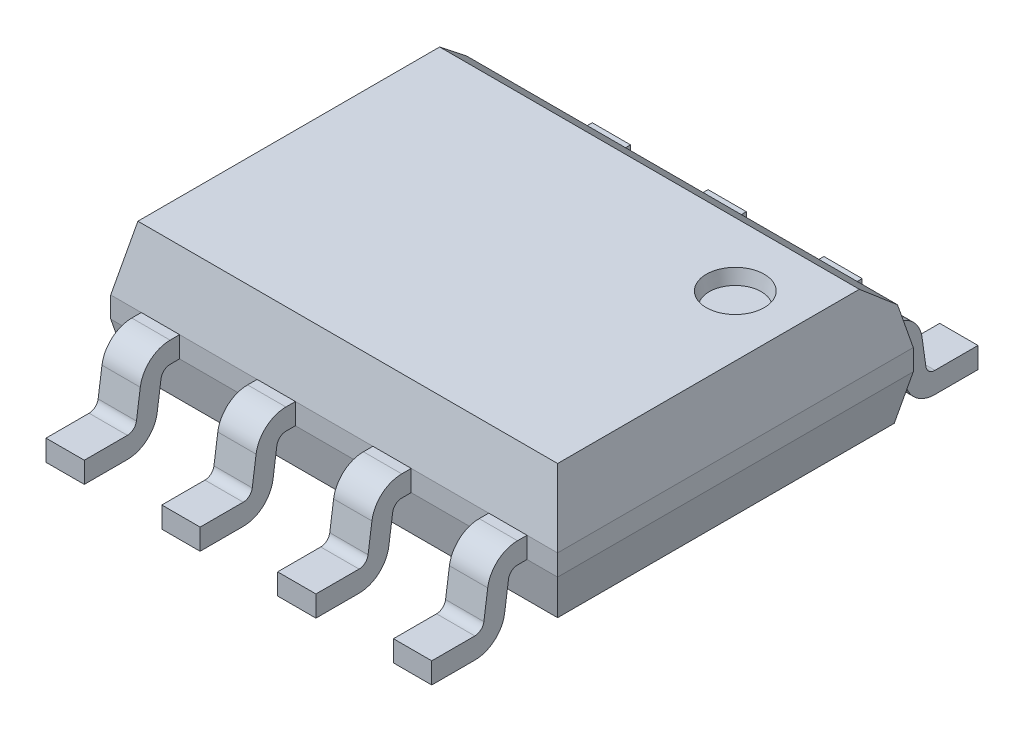
from build123d import *

# Parameters (mm, degrees)
SKETCH1_W                = 4.9
SKETCH1_H                = 3.9
EXTRUDE1_DEPTH           = 0.7
EXTRUDE1_TAPER           = 12
EXTRUDE1_OTHER_WAY_DEPTH = 0.23
SKETCH2_W                = 4.9
SKETCH2_H                = 3.9
EXTRUDE2_DEPTH           = 0.49
EXTRUDE2_TAPER           = 12
CHAMFER1_SIZE            = 0.29360287
CHAMFER1_SIZE_2          = 0.3
SKETCH3_R                = 0.317461986
CUT_EXTRUDE1_DEPTH       = 0.15
CUT_EXTRUDE1_DRAFT       = -12
EXTRUDE3_DEPTH           = 0.21
LPATTERN3_COUNT          = 2
LPATTERN3_PITCH          = 1.27
LPATTERN3_COL_COUNT      = 3
LPATTERN3_COL_PITCH      = 1.27
FILLET1_R                = 0.1
FILLET2_R                = 0.33


with BuildPart() as part:
    # Sketch1 → Extrude1 (new body)
    with BuildSketch(Plane(origin=(0, 0, 0), x_dir=(1, 0, 0), z_dir=(0, 1, 0))):
        with Locations((-0.635, 0)):
            Rectangle(SKETCH1_W, SKETCH1_H)
    extrude(amount=EXTRUDE1_DEPTH, taper=EXTRUDE1_TAPER)

    # Sketch1 → Extrude1 other way (add)
    with BuildSketch(Plane(origin=(0, 0, 0), x_dir=(1, 0, 0), z_dir=(0, 1, 0))):
        with Locations((-0.635, 0)):
            Rectangle(SKETCH1_W, SKETCH1_H)
    extrude(amount=-EXTRUDE1_OTHER_WAY_DEPTH)

    # Sketch2 → Extrude2 (add)
    with BuildSketch(Plane.XZ.offset(0.23)):
        with Locations((-0.635, 0)):
            Rectangle(SKETCH2_W, SKETCH2_H)
    extrude(amount=EXTRUDE2_DEPTH, taper=EXTRUDE2_TAPER)

    # Chamfer1
    # the kernel refuses this chamfer: 0.3, 0.29360287 mm, written as the material it takes off along each edge
    with BuildSketch(Plane(origin=(2.439914076, 0.7, -1.801210407), x_dir=(0, 0.025194664498195983, 0.9996825640576229), z_dir=(-1, 0, 0))) as chamfer1_piece_1:
        Polygon((CHAMFER1_SIZE * 0.999682563914, -CHAMFER1_SIZE * 0.0251946644946), (-CHAMFER1_SIZE_2 * 0.232489792804, -CHAMFER1_SIZE_2 * 0.972598836233), (0, 0), align=None)
    extrude(amount=6.149828151, mode=Mode.SUBTRACT)


with BuildPart() as cut_extrude1_tool:
    # Sketch3 → Cut-Extrude1 (with draft: the straight prism first)
    with BuildSketch(Plane(origin=(0, 0.7, 0), x_dir=(-1, 0, 0), z_dir=(0, 1, 0))):
        with Locations((-1.001533305, -0.811859934)):
            Circle(SKETCH3_R)
    extrude(amount=-CUT_EXTRUDE1_DEPTH)
    # Cut-Extrude1: the draft: its side faces are tilted about the plane it starts from
    cut_extrude1_sides = [cut_extrude1_tool.faces().sort_by_distance(p)[0] for p in [
        (1.318995291, 0.625, -0.811859934),
    ]]
    draft(cut_extrude1_sides, Plane(origin=(0, 0.7, 0), x_dir=(-1, 0, 0), z_dir=(0, 1, 0)), CUT_EXTRUDE1_DRAFT)


with BuildPart() as part_1:
    add(part.part)

    # Cut-Extrude1: cut by cut_extrude1_tool
    add(cut_extrude1_tool.part, mode=Mode.SUBTRACT)

    # Sketch4 → Extrude3 (add, symmetric)
    with BuildSketch(Plane(origin=(0, 0, 0), x_dir=(0, 0, -1), z_dir=(1, 0, 0))):
        Polygon((1.95, -0.23), (-1.95, -0.23), (-2.141337425, -0.23), (-2.235499784, -0.9), (-2.995, -0.9), (-2.995, -0.67), (-2.435435734, -0.67), (-2.341273375, 0), (-1.95, 0), (1.95, 0), (2.341273375, 0), (2.435435734, -0.67), (2.995, -0.67), (2.995, -0.9), (2.235499784, -0.9), (2.141337425, -0.23), align=None)
    extrude3 = extrude(amount=EXTRUDE3_DEPTH, both=True)

    # LPattern3: Extrude3 ×2
    with Locations(*[(i * LPATTERN3_PITCH, 0, 0) for i in range(1, LPATTERN3_COUNT)]):
        add(extrude3)

    # LPattern3 col: Extrude3 ×3
    with Locations(*[(-i * LPATTERN3_COL_PITCH, 0, 0) for i in range(1, LPATTERN3_COL_COUNT)]):
        add(extrude3)

    # Fillet1
    fillet1_edges = [part_1.edges().sort_by_distance(p)[0] for p in [
        (-1.27, -0.23, 2.141337425),
        (-1.27, -0.23, -2.141337425),
        (-1.27, -0.67, -2.435435734),
        (-1.27, -0.67, 2.435435734),
        (-2.54, -0.23, 2.141337425),
        (-2.54, -0.23, -2.141337425),
        (-2.54, -0.67, -2.435435734),
        (-2.54, -0.67, 2.435435734),
        (1.27, -0.23, 2.141337425),
        (1.27, -0.23, -2.141337425),
        (1.27, -0.67, -2.435435734),
        (1.27, -0.67, 2.435435734),
        (0, -0.23, 2.141337425),
        (0, -0.23, -2.141337425),
        (0, -0.67, -2.435435734),
        (0, -0.67, 2.435435734),
    ]]
    fillet(fillet1_edges, radius=FILLET1_R)

    # Fillet2
    fillet2_edges = [part_1.edges().sort_by_distance(p)[0] for p in [
        (-1.27, 0, -2.341273375),
        (-1.27, -0.9, -2.235499784),
        (-1.27, 0, 2.341273375),
        (-1.27, -0.9, 2.235499784),
        (-2.54, 0, -2.341273375),
        (-2.54, -0.9, -2.235499784),
        (-2.54, 0, 2.341273375),
        (-2.54, -0.9, 2.235499784),
        (1.27, 0, -2.341273375),
        (1.27, -0.9, -2.235499784),
        (1.27, 0, 2.341273375),
        (1.27, -0.9, 2.235499784),
        (0, 0, -2.341273375),
        (0, -0.9, -2.235499784),
        (0, 0, 2.341273375),
        (0, -0.9, 2.235499784),
    ]]
    fillet(fillet2_edges, radius=FILLET2_R)


solid = part_1.part
